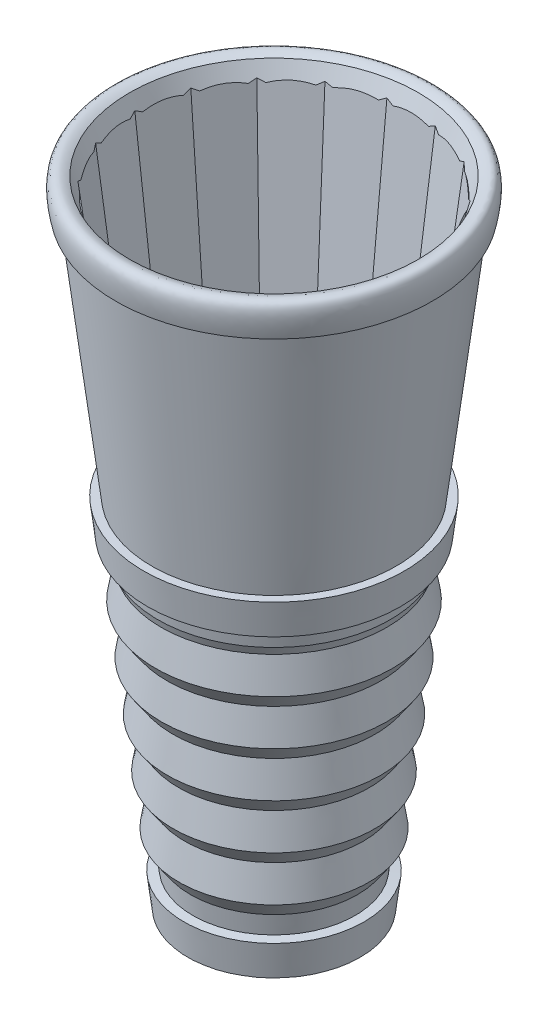
from build123d import *

# Parameters (mm, degrees)
LOFT1_DEPTH        = 508
LOFT1_DRAFT        = -6.7116474
SHELL1_T           = -19.05
SKETCH5_R          = 147.867108762
CUT_EXTRUDE1_DEPTH = 17.78
CUT_EXTRUDE2_DEPTH = 528.39436013
CUT_EXTRUDE2_TAPER = -20
CIRPATTERN1_COUNT  = 18


# Read off the part's stored shape, not the designer's step: Loft1
with BuildPart() as part:
    # Loft1 outline → Loft1 (with draft: the straight prism first)
    with BuildSketch(Plane(origin=(0, -508, 0), x_dir=(1, 0, 0), z_dir=(0, 1, 0))):
        Polygon((33.642737163, -58.270930071), (51.543663709, -43.250269208), (63.227663709, -23.012987572), (67.285474325, 0), (63.227663709, 23.012987572), (51.543663709, 43.250269208), (33.642737163, 58.270930071), (11.684, 66.26325678), (-11.684, 66.26325678), (-33.642737163, 58.270930071), (-51.543663709, 43.250269208), (-63.227663709, 23.012987572), (-67.285474325, 0), (-63.227663709, -23.012987572), (-51.543663709, -43.250269208), (-33.642737163, -58.270930071), (-11.684, -66.26325678), (11.684, -66.26325678), align=None)
    extrude(amount=LOFT1_DEPTH)
    # Loft1: the draft: its side faces are tilted about the plane it starts from
    loft1_sides = [part.faces().sort_by_distance(p)[0] for p in [
        (42.593200436, -254, 50.76059964),
        (57.385663709, -254, 33.13162839),
        (65.256569017, -254, 11.506493786),
        (65.256569017, -254, -11.506493786),
        (57.385663709, -254, -33.13162839),
        (42.593200436, -254, -50.76059964),
        (22.663368581, -254, -62.267093426),
        (0, -254, -66.26325678),
        (-22.663368582, -254, -62.267093426),
        (-42.593200436, -254, -50.76059964),
        (-57.385663709, -254, -33.13162839),
        (-65.256569017, -254, -11.506493786),
        (-65.256569017, -254, 11.506493786),
        (-57.385663709, -254, 33.13162839),
        (-42.593200436, -254, 50.76059964),
        (-22.663368581, -254, 62.267093426),
        (0, -254, 66.26325678),
        (22.663368582, -254, 62.267093426),
    ]]
    draft(loft1_sides, Plane(origin=(0, -508, 0), x_dir=(1, 0, 0), z_dir=(0, 1, 0)), LOFT1_DRAFT)

    # Shell1
    shell1_openings = [part.faces().sort_by_distance(p)[0] for p in [
        (0, 0, 0),
        (0, -508, 0),
    ]]
    offset(amount=SHELL1_T, openings=shell1_openings, kind=Kind.INTERSECTION)

    # Sketch5 → Cut-Extrude1 (cut)
    with BuildSketch(Plane.XZ.offset(508)):
        Circle(SKETCH5_R)
    extrude(amount=-CUT_EXTRUDE1_DEPTH, mode=Mode.SUBTRACT)

    # Sketch6 → Cut-Extrude2 (cut, through all)
    with BuildSketch(Plane(origin=(-55.116718082, -475.589831727, -9.718564486), x_dir=(0.17364817766692822, 0, -0.9848077530122085), z_dir=(-0.11509707458405294, -0.9931469114771136, -0.020294719649782803))):
        Polygon((-12.052935, 125.180446117), (-8.67072745, 106.130446117), (8.67072745, 106.130446117), (12.052935, 125.180446117), align=None)
    cut_extrude2 = extrude(amount=CUT_EXTRUDE2_DEPTH, taper=CUT_EXTRUDE2_TAPER, mode=Mode.SUBTRACT)

    # CirPattern1: Cut-Extrude2 ×18 about axis
    cirpattern1_axis = Axis((0, 0, 0), (0, 1, 0))
    for i in range(1, CIRPATTERN1_COUNT):
        add(cut_extrude2.rotate(cirpattern1_axis, i * 360 / CIRPATTERN1_COUNT), mode=Mode.SUBTRACT)

    # Sketch8 → Cut-Revolve2 (revolve, cut)
    with BuildSketch(Plane.XY, mode=Mode.PRIVATE) as cut_revolve2_sk:
        with BuildLine():
            Line((66.142352279, -490.22), (76.882961085, -490.25713739))
            Line((76.882961085, -490.25713739), (141.822720492, 10.638098649))
            Line((141.822720492, 10.638098649), (99.989622053, 6.074813651))
            Line((99.989622053, 6.074813651), (105.893018165, -15.770882358))
            Line((105.893018165, -15.770882358), (110.947392304, -3.134947011))
            add(Edge.make_bspline(
                [(110.947392304, -3.134947011), (128.530552438, 6.190630718), (121.606117604, -25.658927645)],
                knots=[0, 0, 0, 1, 1, 1], degree=2))
            Line((121.606117604, -25.658927645), (116.526117604, -25.658927645))
            Line((116.526117604, -25.658927645), (93.793358157, -215.9))
            Line((93.793358157, -215.9), (100.143358157, -215.9))
            Line((100.143358157, -215.9), (97.129638261, -241.120576766))
            Line((97.129638261, -241.120576766), (90.779638261, -241.120576766))
            Line((90.779638261, -241.120576766), (89.272293912, -253.734918901))
            Line((89.272293912, -253.734918901), (86.732293912, -260.084918901))
            Line((86.732293912, -260.084918901), (90.942850256, -285.305495666))
            Line((90.942850256, -285.305495666), (82.211714069, -297.915784049))
            Line((82.211714069, -297.915784049), (86.422270412, -323.136360815))
            Line((86.422270412, -323.136360815), (77.691134225, -335.746649197))
            Line((77.691134225, -335.746649197), (81.901690569, -360.967225963))
            Line((81.901690569, -360.967225963), (73.170554382, -373.577514346))
            Line((73.170554382, -373.577514346), (77.381110725, -398.798091112))
            Line((77.381110725, -398.798091112), (68.649974538, -411.408379494))
            Line((68.649974538, -411.408379494), (72.860530881, -436.62895626))
            Line((72.860530881, -436.62895626), (64.129394694, -449.239244643))
            Line((64.129394694, -449.239244643), (62.364857752, -464.005925341))
            Line((62.364857752, -464.005925341), (69.177512262, -464.82))
            Line((69.177512262, -464.82), (66.142352279, -490.22))
        make_face()
    revolve(cut_revolve2_sk.sketch.rotate(Axis((0, 19.581938079, 0), (0, -1, 0)), 180), axis=Axis((0, 19.581938079, 0), (0, -1, 0)), mode=Mode.SUBTRACT)


solid = part.part
